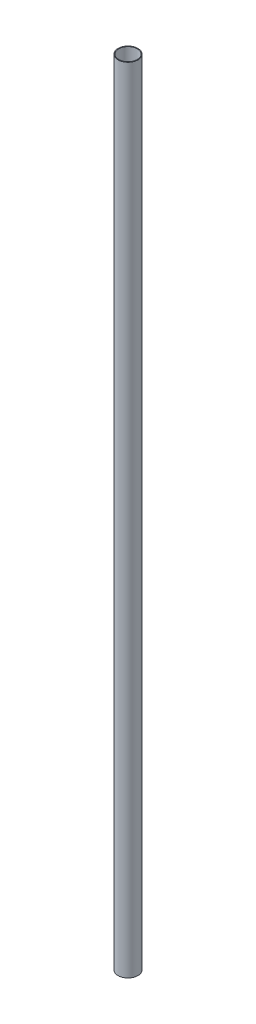
from build123d import *

# Parameters (mm, degrees)
SKETCH5_R           = 3.5
SKETCH5_R_2         = 3.25
BOSS_EXTRUDE3_DEPTH = 278


with BuildPart() as part:
    # Sketch5 → Boss-Extrude3 (new body)
    with BuildSketch(Plane(origin=(0, 0, 0), x_dir=(1, 0, 0), z_dir=(0, 1, 0))):
        Circle(SKETCH5_R)
        Circle(SKETCH5_R_2, mode=Mode.SUBTRACT)
    extrude(amount=-BOSS_EXTRUDE3_DEPTH)


solid = part.part
